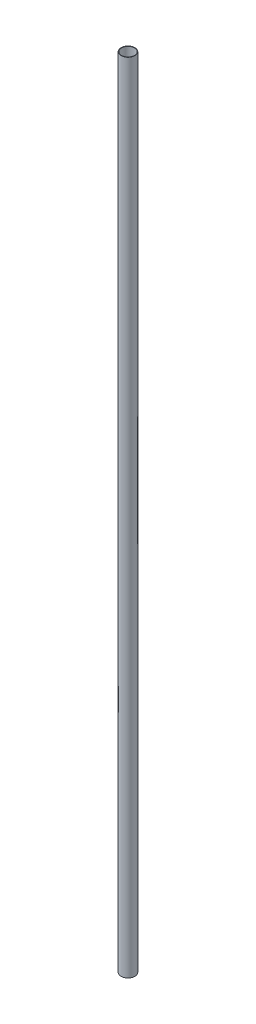
from build123d import *

# Parameters (mm, degrees)
SKETCH1_R           = 20.955
SKETCH1_R_2         = 19.685
BOSS_EXTRUDE1_DEPTH = 2413


with BuildPart() as part:
    # Sketch1 → Boss-Extrude1 (new body)
    with BuildSketch(Plane(origin=(0, 0, 0), x_dir=(1, 0, 0), z_dir=(0, 1, 0))):
        Circle(SKETCH1_R)
        Circle(SKETCH1_R_2, mode=Mode.SUBTRACT)
    extrude(amount=BOSS_EXTRUDE1_DEPTH)


solid = part.part
